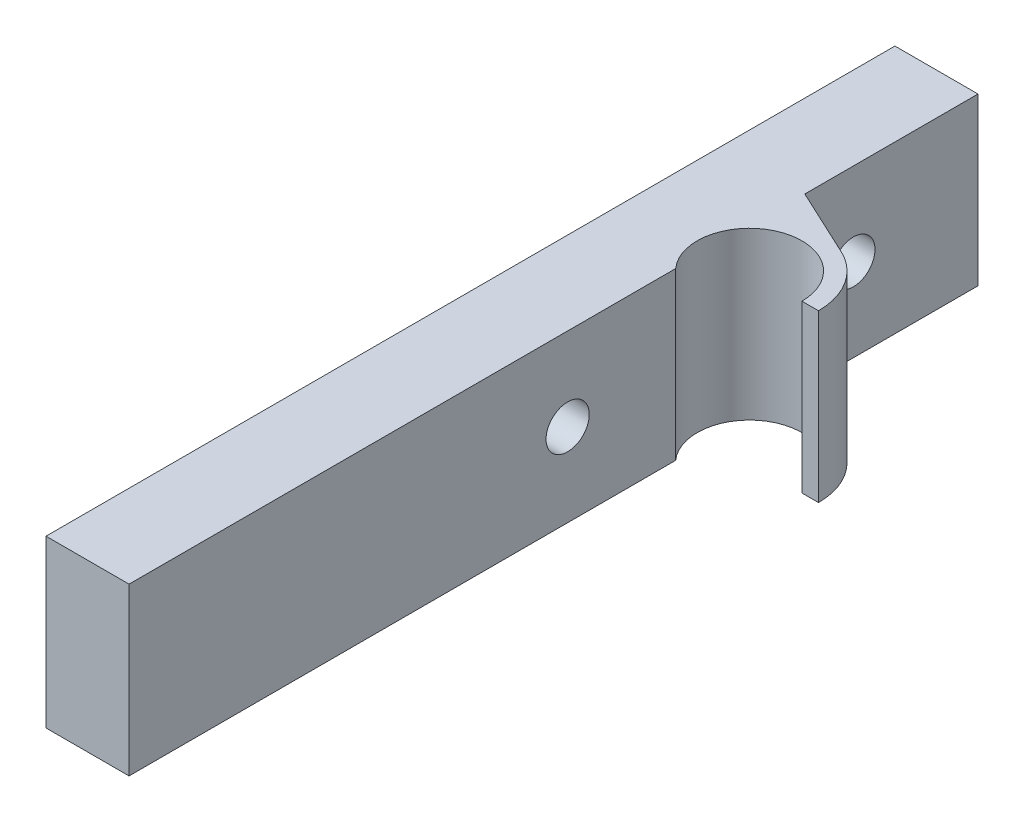
from build123d import *

# Parameters (mm, degrees)
BOSS_EXTRUDE1_DEPTH      = 12.7
BOSS_EXTRUDE1_DEPTH_BACK = 12.7
CUT_EXTRUDE1_DEPTH       = 95.433702141
CUT_EXTRUDE1_DEPTH_BACK  = 95.433702141
SKETCH5_R                = 3.302


with BuildPart() as part:
    # Sketch3 → Boss-Extrude1 (new, two sides: drawn at the far end of the back side and taken through both)
    with BuildSketch(Plane(origin=(0, 0, 0), x_dir=(1, 0, 0), z_dir=(0, 1, 0)).offset(-BOSS_EXTRUDE1_DEPTH_BACK)):
        with BuildLine():
            Line((8.001, 0), (10.541, 0))
            ThreePointArc((10.541, 0), (8.89018923, 5.663675172), (4.454819097, 9.553390383))
            Line((4.454819097, 9.553390383), (-5.969, 14.414097055))
            Line((-5.969, 14.414097055), (-5.969, 40.894))
            Line((-5.969, 40.894), (-18.669, 40.894))
            Line((-18.669, 40.894), (-18.669, -88.9))
            Line((-18.669, -88.9), (-5.969, -88.9))
            Line((-5.969, -88.9), (-5.969, -5.327948949))
            ThreePointArc((-5.969, -5.327948949), (-2.851142929, 7.475759828), (8.001, 0))
        make_face()
    extrude(amount=BOSS_EXTRUDE1_DEPTH + BOSS_EXTRUDE1_DEPTH_BACK)

    # Sketch5 → Cut-Extrude1 (cut, two sides: drawn at the far end of the back side and taken through both)
    with BuildSketch(Plane.ZY.offset(18.669).offset(-CUT_EXTRUDE1_DEPTH_BACK)):
        with Locations((-21.844, 0)):
            Circle(SKETCH5_R)
        with Locations((21.844, 0)):
            Circle(SKETCH5_R)
    extrude(amount=CUT_EXTRUDE1_DEPTH + CUT_EXTRUDE1_DEPTH_BACK, mode=Mode.SUBTRACT)


solid = part.part
